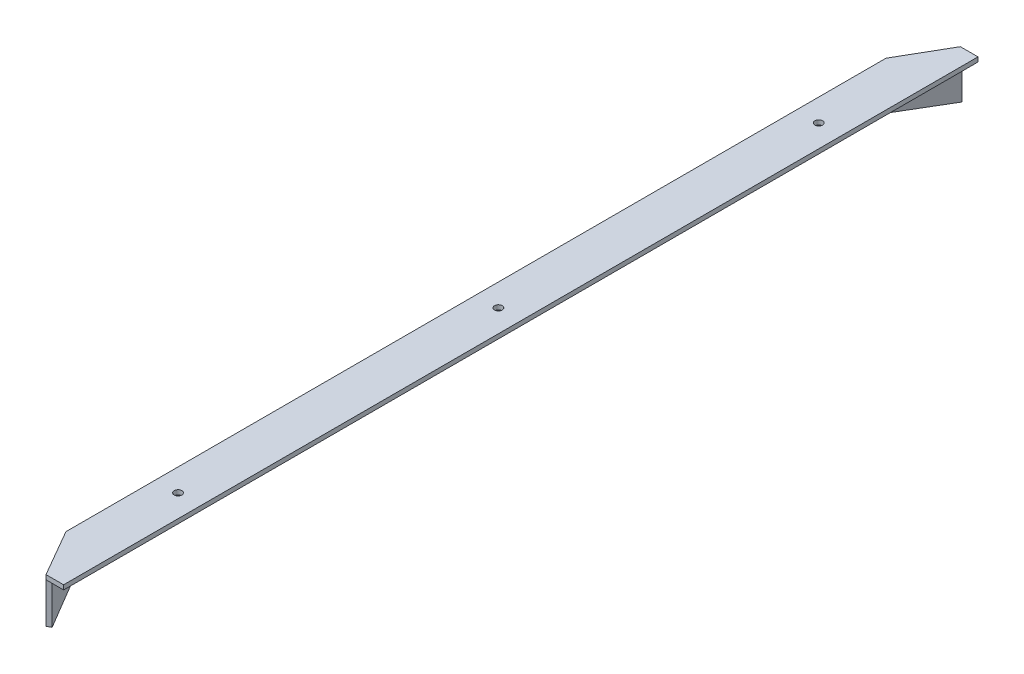
from build123d import *
from build123d.topology import SkipClean

# Parameters (mm, degrees)
BOSS_EXTRUDE1_DEPTH = 640
SKETCH22_R          = 6
CUT_EXTRUDE4_DEPTH  = 10
BOSS_EXTRUDE2_DEPTH = 63
BOSS_EXTRUDE3_DEPTH = 7


with BuildPart() as part:
    # Sketch1 → Boss-Extrude1 (new body)
    with BuildSketch(Plane.XY):
        Polygon((0, 0), (0, 70), (70, 70), (70, 63), (7, 63), (7, 0), align=None)
    extrude(amount=BOSS_EXTRUDE1_DEPTH)

    # Sketch22 → Cut-Extrude4 (cut)
    with BuildSketch(Plane(origin=(0, 70, 0), x_dir=(1, 0, 0), z_dir=(0, 1, 0))):
        with Locations((35, 0)):
            Circle(SKETCH22_R)
        with Locations((35, 500)):
            Circle(SKETCH22_R)
        with Locations((35, -500)):
            Circle(SKETCH22_R)
    extrude(amount=-CUT_EXTRUDE4_DEPTH, mode=Mode.SUBTRACT)

    # Sketch23 → Boss-Extrude2 (add)
    with BuildSketch(Plane(origin=(0, 0, 0), x_dir=(1, 0, 0), z_dir=(0, 1, 0))):
        Polygon((0, -640), (42.5, -713.612159322), (48.562177826, -710.112159322), (7, -640), align=None)
    extrude(amount=BOSS_EXTRUDE2_DEPTH)

    # Sketch25 → Boss-Extrude3 (add)
    with BuildSketch(Plane(origin=(0, 63, 0), x_dir=(1, 0, 0), z_dir=(0, 1, 0))):
        Polygon((70, -640), (0, -640), (42.5, -713.612159322), (70, -713.612159322), align=None)
    extrude(amount=BOSS_EXTRUDE3_DEPTH)

    # Mirror1: part across plane


with BuildPart() as part_1:
    with SkipClean():  # the faces are left unmerged after this step: merging them gives an invalid solid
        add(part.part)
        add(part.part.mirror(Plane.XY))


solid = part_1.part
